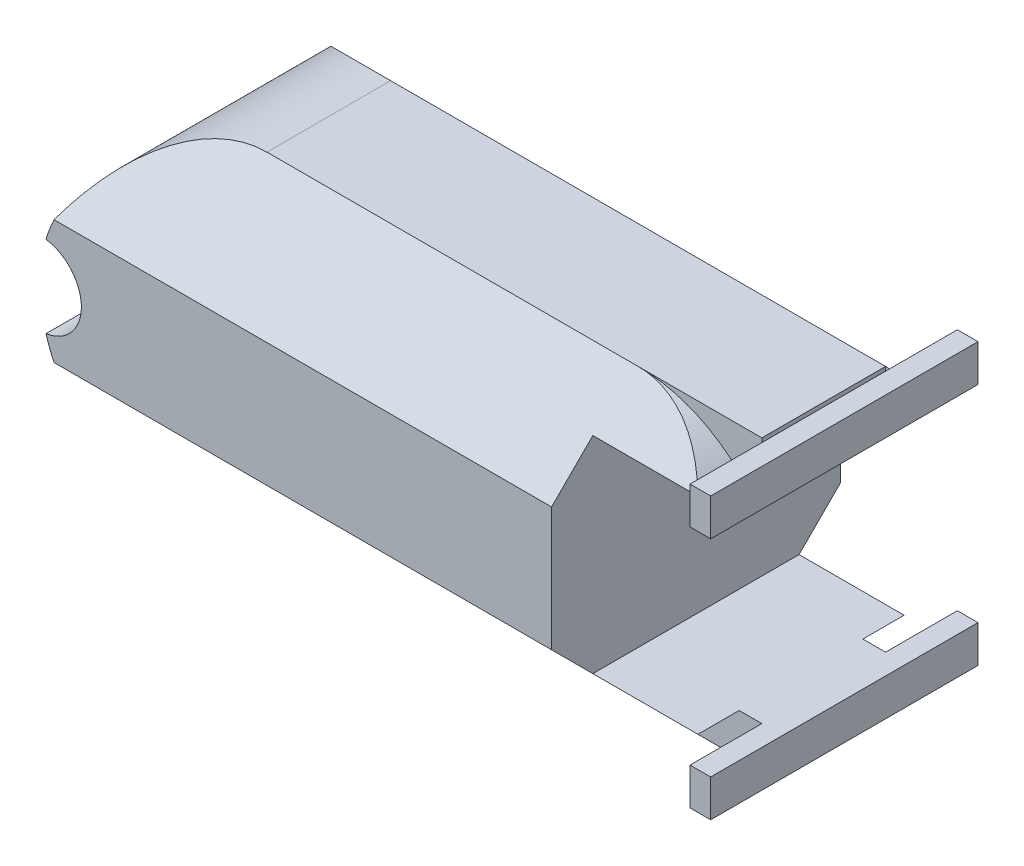
from build123d import *

# Parameters (mm, degrees)
IZIM1_W                     = 80
IZIM1_H                     = 35
Y_KSEKLIK_EKSTR_ZYON1_DEPTH = 35
RADYUS1_R                   = 17.5
RADYUS2_R                   = 17.5
RADYUS3_R                   = 17.5
IZIM2_R                     = 5
KES_EKSTR_ZYON1_DEPTH       = 56.957573214
PAH1_SIZE                   = 10
IZIM3_W                     = 37.5
IZIM3_H                     = 15
Y_KSEKLIK_EKSTR_ZYON2_DEPTH = 5
IZIM4_W                     = 37.5
IZIM4_H                     = 15
Y_KSEKLIK_EKSTR_ZYON3_DEPTH = 5
IZIM6_W                     = 17.989484019
IZIM6_H                     = 35
KES_EKSTR_ZYON2_DEPTH       = 25
IZIM7_W                     = 32.408876432
IZIM7_H                     = 4.5
Y_KSEKLIK_EKSTR_ZYON4_DEPTH = 2.5


# Some blends are built 0.0001 mm under size
with BuildPart() as part:
    # Çizim1 → Yükseklik-Ekstrüzyon1 (new body)
    with BuildSketch(Plane.XY):
        Rectangle(IZIM1_W, IZIM1_H)
    extrude(amount=Y_KSEKLIK_EKSTR_ZYON1_DEPTH)

    # Radyus1
    radyus1_edges = [part.edges().sort_by_distance(p)[0] for p in [
        (-40, 17.5, 17.5),
    ]]
    fillet(radyus1_edges, radius=RADYUS1_R)

    # Radyus2
    radyus2_edges = [part.edges().sort_by_distance(p)[0] for p in [
        (-40, -17.5, 17.5),
    ]]
    fillet(radyus2_edges, radius=RADYUS2_R - 0.0001)  # a hair under: the kernel refuses the full size

    # Radyus3
    radyus3_edges = [part.edges().sort_by_distance(p)[0] for p in [
        (40, -17.5, 17.5),
        (40, 17.5, 17.5),
    ]]
    fillet(radyus3_edges, radius=RADYUS3_R - 0.0001)  # a hair under: the kernel refuses the full size

    # Çizim2 → Kes-Ekstrüzyon1 (cut, through all)
    with BuildSketch(Plane.XY.offset(35)):
        with Locations((-40, 0)):
            Circle(IZIM2_R)
    extrude(amount=-KES_EKSTR_ZYON1_DEPTH, mode=Mode.SUBTRACT)

    # Pah1
    # the kernel refuses this chamfer: 10 mm, written as the material it takes off along each edge
    with BuildSketch(Plane(origin=(48.21692988, -17.5, 0), x_dir=(0, 0.9996219169112968, -0.027495876610586372), z_dir=(-1, 0, 0))) as pah1_piece_1:
        Polygon((PAH1_SIZE * 0.999621916911, -PAH1_SIZE * 0.0274958766106), (-PAH1_SIZE * 0.0274958766106, -PAH1_SIZE * 0.999621916911), (0, 0), align=None)
    extrude(amount=96.433859759, mode=Mode.SUBTRACT)
    with BuildSketch(Plane(origin=(48.21692988, -17.5, 35), x_dir=(0, 0.9996219169112968, 0.027495876610586317), z_dir=(-1, 0, 0))) as pah1_piece_2:
        Polygon((PAH1_SIZE * 0.999621916911, PAH1_SIZE * 0.0274958766106), (-PAH1_SIZE * 0.0274958766106, PAH1_SIZE * 0.999621916911), (0, 0), align=None)
    extrude(amount=96.433859759, mode=Mode.SUBTRACT)
    with BuildSketch(Plane(origin=(-48.21682988, 17.5, 0), x_dir=(0, -0.9996219169112968, -0.027495876610586372), z_dir=(1, 0, 0))) as pah1_piece_3:
        Polygon((PAH1_SIZE * 0.999621916911, -PAH1_SIZE * 0.0274958766106), (-PAH1_SIZE * 0.0274958766106, -PAH1_SIZE * 0.999621916911), (0, 0), align=None)
    extrude(amount=96.433759759, mode=Mode.SUBTRACT)
    with BuildSketch(Plane(origin=(-48.21682988, 17.5, 35), x_dir=(0, -0.9996219169112968, 0.027495876610586317), z_dir=(1, 0, 0))) as pah1_piece_4:
        Polygon((PAH1_SIZE * 0.999621916911, PAH1_SIZE * 0.0274958766106), (-PAH1_SIZE * 0.0274958766106, PAH1_SIZE * 0.999621916911), (0, 0), align=None)
    extrude(amount=96.433759759, mode=Mode.SUBTRACT)

    # Çizim3 → Yükseklik-Ekstrüzyon2 (add)
    with BuildSketch(Plane(origin=(0, 17.5, 0), x_dir=(1, 0, 0), z_dir=(0, 1, 0))):
        with Locations((18.75, -17.5)):
            Rectangle(IZIM3_W, IZIM3_H)
    extrude(amount=-Y_KSEKLIK_EKSTR_ZYON2_DEPTH)

    # Çizim4 → Yükseklik-Ekstrüzyon3 (add)
    with BuildSketch(Plane.XZ.offset(17.5)):
        with Locations((18.75, 17.5)):
            Rectangle(IZIM4_W, IZIM4_H)
    extrude(amount=-Y_KSEKLIK_EKSTR_ZYON3_DEPTH)

    # Çizim6 → Kes-Ekstrüzyon2 (cut)
    with BuildSketch(Plane(origin=(0, -12.5, 0), x_dir=(1, 0, 0), z_dir=(0, 1, 0))):
        with Locations((31.00525799, -17.5)):
            Rectangle(IZIM6_W, IZIM6_H)
    extrude(amount=KES_EKSTR_ZYON2_DEPTH, mode=Mode.SUBTRACT)

    # Çizim7 → Yükseklik-Ekstrüzyon4 (add)
    with BuildSketch(Plane(origin=(37.5, 0, 0), x_dir=(0, 0, -1), z_dir=(1, 0, 0))):
        with Locations((-17.5, 14.75)):
            Rectangle(IZIM7_W, IZIM7_H)
        with Locations((-17.5, -14.75)):
            Rectangle(IZIM7_W, IZIM7_H)
    extrude(amount=Y_KSEKLIK_EKSTR_ZYON4_DEPTH)


solid = part.part
